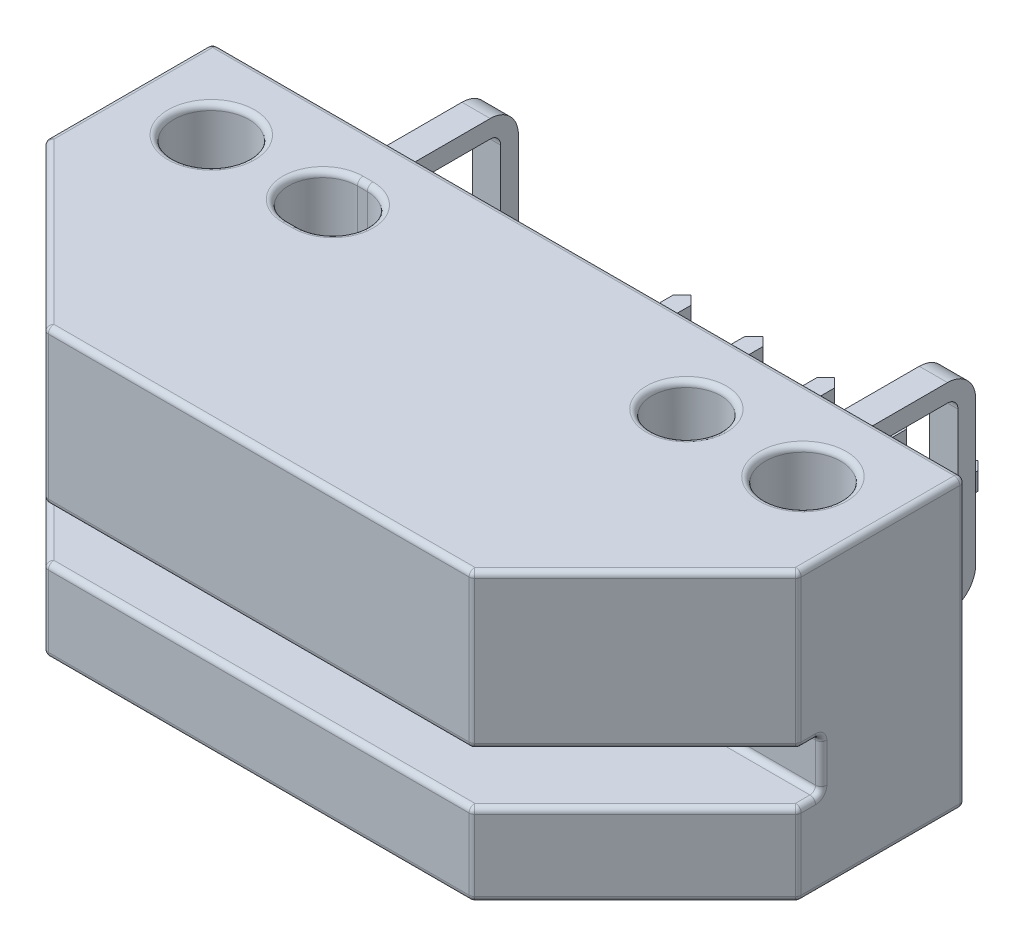
from build123d import *

# Parameters (mm, degrees)
BOSS_EXTRUDE1_DEPTH  = 10.16
SKETCH2_W            = 26.67
SKETCH2_H            = 6.59
CUT_EXTRUDE1_DEPTH   = 0.89
BOSS_EXTRUDE2_DEPTH  = 0.63
LPATTERN1_COUNT      = 3
LPATTERN1_PITCH      = 2.54
LPATTERN1_COUNT_DIR2 = 3
LPATTERN1_PITCH_DIR2 = 2.54
SKETCH4_R            = 1.335
CUT_EXTRUDE2_DEPTH   = 24.417308236
SKETCH5_R            = 1.22
CUT_EXTRUDE3_DEPTH   = 2.16
SKETCH6_W            = 1
SKETCH6_H            = 0.63
LPATTERN3_COUNT      = 2
LPATTERN3_PITCH      = 16.2
SKETCH8_R            = 1.22
CUT_EXTRUDE4_DEPTH   = 2.16
FILLET2_R            = 0.2
FILLET3_R            = 0.2


with BuildPart() as part:
    # Sketch1 → Boss-Extrude1 (new body)
    with BuildSketch(Plane(origin=(0, 0, 0), x_dir=(1, 0, 0), z_dir=(0, 1, 0))):
        Polygon((-13.335, 7.65), (13.335, 7.65), (13.335, 1.75), (7.535, -4.05), (-7.535, -4.05), (-13.335, 1.75), align=None)
    extrude(amount=BOSS_EXTRUDE1_DEPTH)

    # Sketch2 → Cut-Extrude1 (cut, symmetric)
    with BuildSketch(Plane(origin=(0, 3.81, 0), x_dir=(1, 0, 0), z_dir=(0, 1, 0))):
        with Locations((0, -0.755)):
            Rectangle(SKETCH2_W, SKETCH2_H)
    extrude(amount=CUT_EXTRUDE1_DEPTH, both=True, mode=Mode.SUBTRACT)

    # Sketch3 → Boss-Extrude2 (add)
    with BuildSketch(Plane(origin=(0, 1.52, 0), x_dir=(1, 0, 0), z_dir=(0, 1, 0))):
        Polygon((-0.65, 7.65), (-0.65, 9.115), (-0.315, 9.45), (-0.315, 16.035), (0, 16.35), (0.315, 16.035), (0.315, 9.45), (0.65, 9.115), (0.65, 7.65), align=None)
    boss_extrude2 = extrude(amount=BOSS_EXTRUDE2_DEPTH)

    # LPattern1: Boss-Extrude2 3 × 3
    with Locations(*[Vector(1, 0, 0) * (i * LPATTERN1_PITCH) + Vector(-1, 0, 0) * (j * LPATTERN1_PITCH_DIR2) for i in range(LPATTERN1_COUNT) for j in range(LPATTERN1_COUNT_DIR2) if (i, j) != (0, 0)]):
        add(boss_extrude2)

    # Sketch4 → Cut-Extrude2 (cut, through all)
    with BuildSketch(Plane.XZ):
        with Locations((10.48, -4.75)):
            Circle(SKETCH4_R)
        with Locations((-10.48, -4.75)):
            Circle(SKETCH4_R)
    extrude(amount=-CUT_EXTRUDE2_DEPTH, mode=Mode.SUBTRACT)

    # Sketch5 → Cut-Extrude3 (cut)
    with BuildSketch(Plane.XZ):
        with Locations((8.64, 0)):
            Circle(SKETCH5_R)
        with BuildLine():
            Line((-8.455, -1.22), (-8.805, -1.22))
            ThreePointArc((-8.805, -1.22), (-10.025, 0), (-8.805, 1.22))
            Line((-8.805, 1.22), (-8.455, 1.22))
            ThreePointArc((-8.455, 1.22), (-7.235, 0), (-8.455, -1.22))
        make_face()
    extrude(amount=-CUT_EXTRUDE3_DEPTH, mode=Mode.SUBTRACT)

    # Sweep1: sweep along a path in Sketch7
    with BuildLine(Plane(origin=(-7.6, 0, 0), x_dir=(0, 0, -1), z_dir=(1, 0, 0))) as sweep1_path:
        Line((7.65, 1.52), (11.75, 1.52))
        ThreePointArc((11.75, 1.52), (12.457106781, 1.812893219), (12.75, 2.52))
        Line((12.75, 2.52), (12.75, 7.6))
        ThreePointArc((12.75, 7.6), (12.457106781, 8.307106781), (11.75, 8.6))
        Line((11.75, 8.6), (7.65, 8.6))
    # Sketch6 → Sweep1 (sweep)
    with BuildSketch(Plane(origin=(0, 0, -7.65), x_dir=(-1, 0, 0), z_dir=(0, 0, -1))):
        with Locations((8.1, 1.835)):
            Rectangle(SKETCH6_W, SKETCH6_H)
    sweep1 = sweep(path=sweep1_path.line)

    # LPattern3: Sweep1 ×2
    with Locations(*[(i * LPATTERN3_PITCH, 0, 0) for i in range(1, LPATTERN3_COUNT)]):
        add(sweep1)

    # Sketch8 → Cut-Extrude4 (cut)
    with BuildSketch(Plane(origin=(0, 10.16, 0), x_dir=(1, 0, 0), z_dir=(0, 1, 0))):
        with Locations((6.35, 4.75)):
            Circle(SKETCH8_R)
        with BuildLine():
            Line((-6.175, 5.97), (-6.525, 5.97))
            ThreePointArc((-6.525, 5.97), (-7.745, 4.75), (-6.525, 3.53))
            Line((-6.525, 3.53), (-6.175, 3.53))
            ThreePointArc((-6.175, 3.53), (-4.955, 4.75), (-6.175, 5.97))
        make_face()
    extrude(amount=-CUT_EXTRUDE4_DEPTH, mode=Mode.SUBTRACT)

    # Fillet2
    fillet2_edges = [part.edges().sort_by_distance(p)[0] for p in [
        (-7.535, 1.46, 4.05),
        (-10.435, 0, 1.15),
        (-10.435, 2.92, 1.15),
        (-13.335, 1.46, -1.75),
        (-13.335, 0, -4.7),
        (-13.335, 5.08, -7.65),
        (-13.335, 10.16, -4.7),
        (-13.335, 7.43, -1.75),
        (-13.335, 4.7, -2.145),
        (-13.335, 3.81, -2.54),
        (-13.335, 2.92, -2.145),
        (13.335, 4.7, -2.145),
        (13.335, 3.81, -2.54),
        (13.335, 2.92, -2.145),
        (13.335, 1.46, -1.75),
        (13.335, 7.43, -1.75),
        (10.435, 10.16, 1.15),
        (10.435, 2.92, 1.15),
        (10.435, 0, 1.15),
        (10.435, 4.7, 1.15),
        (7.535, 7.43, 4.05),
        (7.535, 1.46, 4.05),
        (0, 2.92, 4.05),
        (0, 0, 4.05),
        (0, 4.7, 4.05),
        (0, 10.16, 4.05),
        (-7.535, 7.43, 4.05),
        (-10.435, 10.16, 1.15),
        (-10.435, 4.7, 1.15),
        (13.335, 0, -4.7),
        (13.335, 10.16, -4.7),
        (13.335, 5.08, -7.65),
        (0, 10.16, -7.65),
        (0, 0, -7.65),
        (0, 2.92, -2.54),
        (0, 4.7, -2.54),
    ]]
    fillet(fillet2_edges, radius=FILLET2_R)

    # Fillet3
    fillet3_edges = [part.edges().sort_by_distance(p)[0] for p in [
        (-6.35, 10.16, -3.53),
        (-7.745, 10.16, -4.75),
        (-6.35, 10.16, -5.97),
        (-8.63, 0, 1.22),
        (-7.235, 0, 0),
        (-8.63, 0, -1.22),
        (9.145, 10.16, -4.75),
        (5.13, 10.16, -4.75),
        (-4.955, 10.16, -4.75),
        (-11.815, 10.16, -4.75),
        (9.145, 0, -4.75),
        (7.42, 0, 0),
        (-10.025, 0, 0),
        (-11.815, 0, -4.75),
    ]]
    fillet(fillet3_edges, radius=FILLET3_R)


solid = part.part
